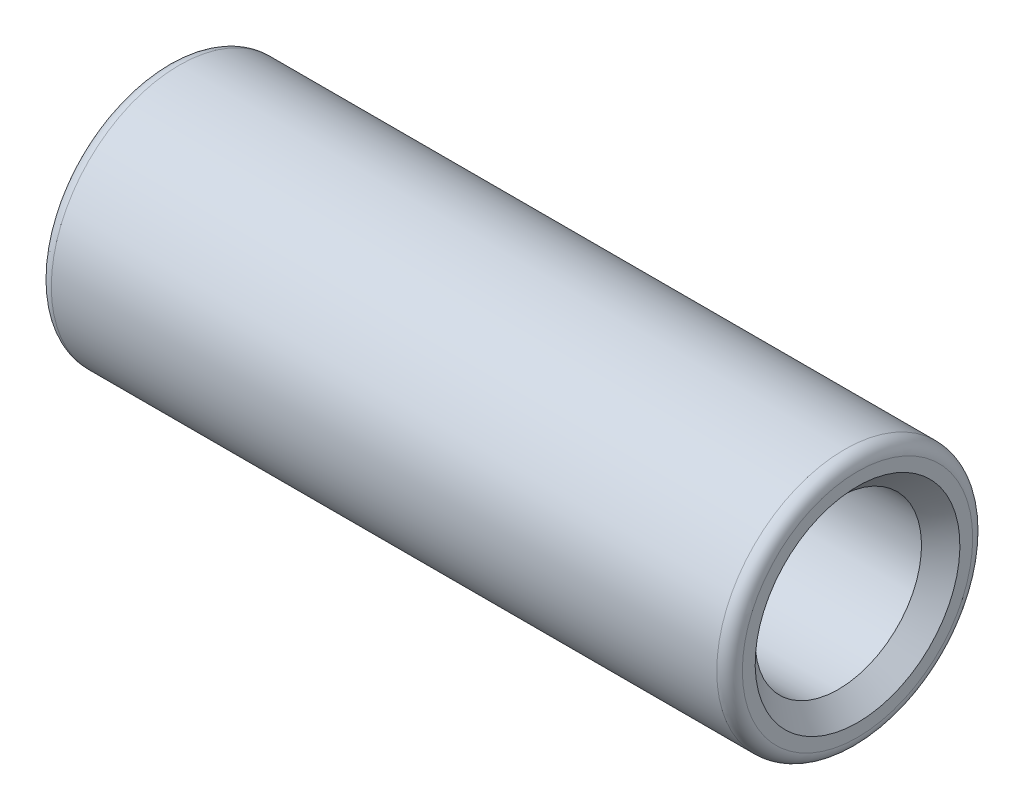
from build123d import *

# Parameters (mm, degrees)
CHAMFER1_SIZE = 1.5
FILLET1_R     = 1


with BuildPart() as part:
    # Sketch1 → Revolve1 (revolve)
    with BuildSketch(Plane.XY):
        Polygon((25, 4.05), (0, 4.05), (0, 10), (54, 10), (54, 6.5), (30, 6.5), (30, 2.775), (36, 2.775), (36, 0), (25, 0), align=None)
    revolve(axis=Axis((0, 0, 0), (1, 0, 0)))

    # Chamfer1
    chamfer1_edges = [part.edges().sort_by_distance(p)[0] for p in [
        (36, -2.775, 0),
        (54, -6.5, 0),
        (0, -4.05, 0),
    ]]
    chamfer(chamfer1_edges, length=CHAMFER1_SIZE)

    # Fillet1
    fillet1_edges = [part.edges().sort_by_distance(p)[0] for p in [
        (0, -10, 0),
        (54, -10, 0),
    ]]
    fillet(fillet1_edges, radius=FILLET1_R)


solid = part.part
